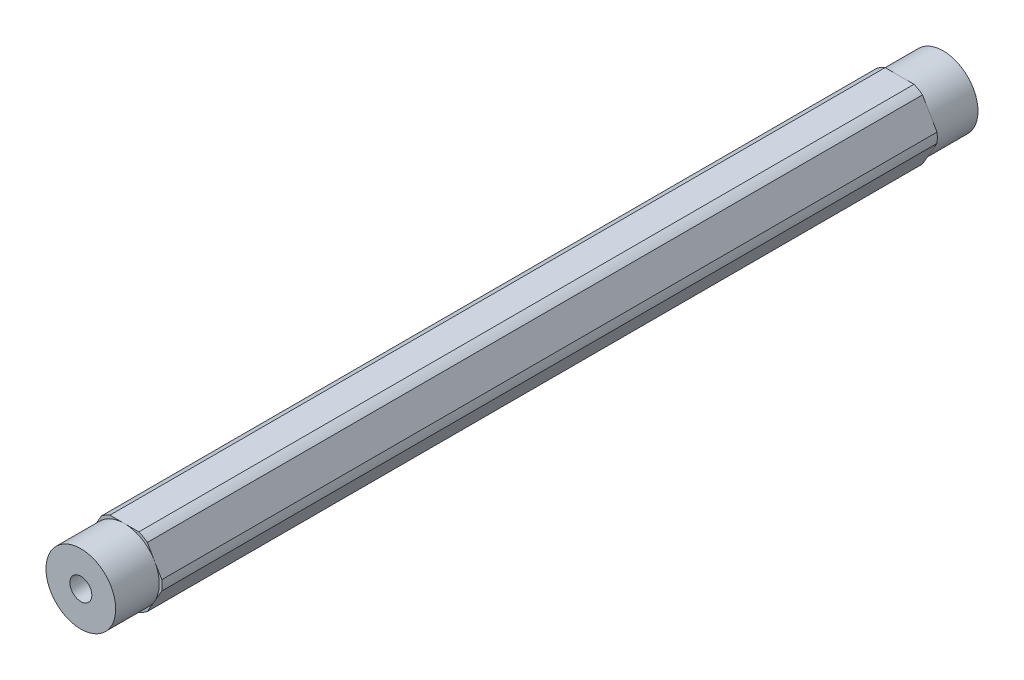
from build123d import *

# Parameters (mm, degrees)
SKETCH1_R           = 2.000000064
BOSS_EXTRUDE1_DEPTH = 70.61835
SKETCH4_R           = 6.35
SKETCH4_R_2         = 2.000000064
BOSS_EXTRUDE2_DEPTH = 7.9375


with BuildPart() as part:
    # Sketch1 → Boss-Extrude1 (new, symmetric)
    with BuildSketch(Plane.XY):
        with BuildLine():
            ThreePointArc((4.181770846, 5.456960429), (3.437499983, 5.953924622), (2.634980936, 6.35))
            Line((2.634980936, 6.35), (-2.634980936, 6.35))
            ThreePointArc((-2.634980936, 6.35), (-3.437499983, 5.953924622), (-4.181770846, 5.456960429))
            Line((-4.181770846, 5.456960429), (-6.816751782, 0.893039571))
            ThreePointArc((-6.816751782, 0.893039571), (-6.874999966, 0), (-6.816751782, -0.893039571))
            Line((-6.816751782, -0.893039571), (-4.181770846, -5.456960429))
            ThreePointArc((-4.181770846, -5.456960429), (-3.437499983, -5.953924622), (-2.634980936, -6.35))
            Line((-2.634980936, -6.35), (2.634980936, -6.35))
            ThreePointArc((2.634980936, -6.35), (3.437499983, -5.953924622), (4.181770846, -5.456960429))
            Line((4.181770846, -5.456960429), (6.816751782, -0.893039571))
            ThreePointArc((6.816751782, -0.893039571), (6.860422465, -0.447468582), (6.874999966, 0))
            ThreePointArc((6.874999966, 0), (6.860422465, 0.447468582), (6.816751782, 0.893039571))
            Line((6.816751782, 0.893039571), (4.181770846, 5.456960429))
        make_face()
        Circle(SKETCH1_R, mode=Mode.SUBTRACT)
    extrude(amount=BOSS_EXTRUDE1_DEPTH, both=True)

    # Sketch4 → Boss-Extrude2 (add)
    with BuildSketch(Plane.XY.offset(70.61835)):
        Circle(SKETCH4_R)
        Circle(SKETCH4_R_2, mode=Mode.SUBTRACT)
    boss_extrude2 = extrude(amount=BOSS_EXTRUDE2_DEPTH)

    # Mirror1: Boss-Extrude2 across plane
    add(boss_extrude2.mirror(Plane.XY))


solid = part.part
